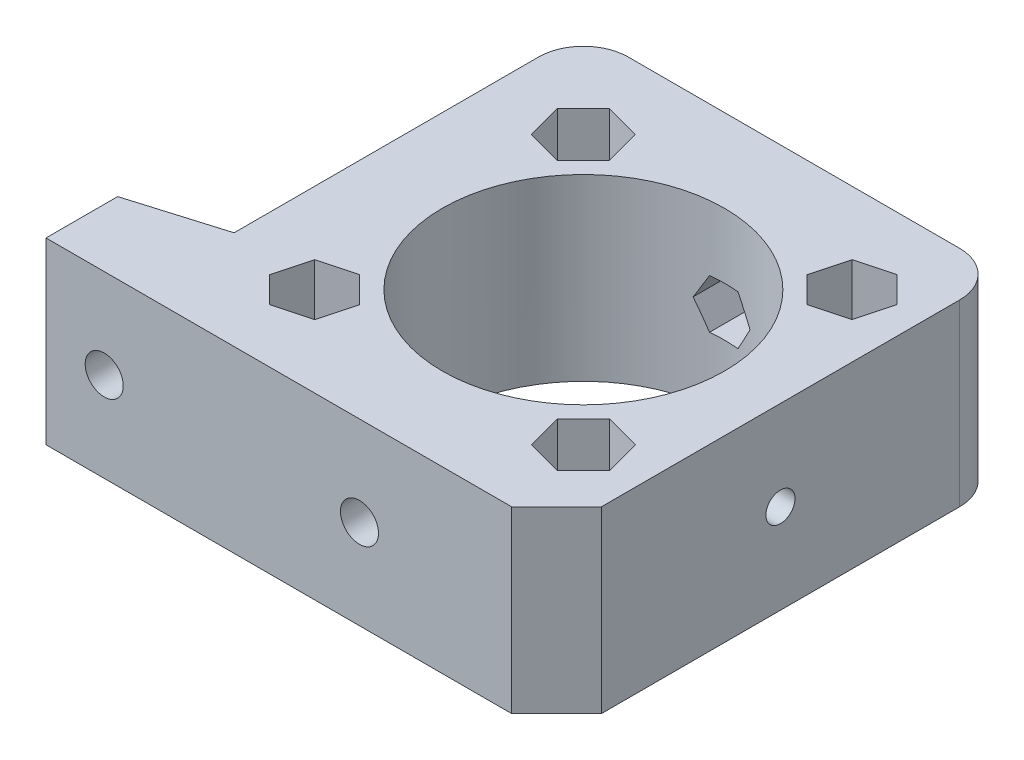
from build123d import *

# Parameters (mm, degrees)
CROQUIS1_R               = 2.125
CROQUIS1_R_2             = 15.75
SALIENTE_EXTRUIR1_DEPTH  = 20
CORTAR_EXTRUIR1_REACH    = 66.226
CROQUIS3_R               = 2.125
CORTAR_EXTRUIR2_REACH    = 71.226
CORTAR_EXTRUIR2_START    = -5
CORTAR_EXTRUIR3_DEPTH    = 10
CUT_EXTRUDE1_DEPTH       = 48.434164903
REDONDEO1_R              = 5
CUT_EXTRUDE2_DEPTH       = 48.434164903
SKETCH3_R                = 1.625
CUT_EXTRUDE3_DEPTH       = 10
CUT_EXTRUDE4_REACH       = 71.376
CUT_EXTRUDE4_START       = -4
CUT_EXTRUDE5_REACH       = 66.226
SKETCH5_R                = 1.625
CUT_EXTRUDE6_REACH       = 70.226
CUT_EXTRUDE6_START       = -4
REDONDEO1_OF_SIMETR_A1_R = 5
CROQUIS6_W               = 57
CROQUIS6_H               = 20
CORTAR_EXTRUIR4_DEPTH    = 73.972597597


with BuildPart() as part:
    # Croquis1 → Saliente-Extruir1 (new body)
    with BuildSketch(Plane(origin=(0, 0, 0), x_dir=(1, 0, 0), z_dir=(0, 1, 0))):
        Polygon((25, 25), (-25, 25), (-25, -14), (-35, -17), (-35, -25), (25, -25), align=None)
        with Locations((-15, -15)):
            Circle(CROQUIS1_R, mode=Mode.SUBTRACT)
        with Locations((15, -15)):
            Circle(CROQUIS1_R, mode=Mode.SUBTRACT)
        with Locations((-15, 15)):
            Circle(CROQUIS1_R, mode=Mode.SUBTRACT)
        Circle(CROQUIS1_R_2, mode=Mode.SUBTRACT)
        with Locations((15, 15)):
            Circle(CROQUIS1_R, mode=Mode.SUBTRACT)
    saliente_extruir1 = extrude(amount=-SALIENTE_EXTRUIR1_DEPTH)

    # Croquis3 → Cortar-Extruir1 (cut, up to next)
    with BuildSketch(Plane.XY.offset(25), mode=Mode.PRIVATE) as cortar_extruir1_sk1:
        with Locations((-28.5, -10)):
            Circle(CROQUIS3_R)
    cortar_extruir1_tool1 = extrude(cortar_extruir1_sk1.sketch, amount=-CORTAR_EXTRUIR1_REACH, mode=Mode.PRIVATE) & part.part
    # Croquis3 → Cortar-Extruir1 (cut, up to next)
    with BuildSketch(Plane.XY.offset(25), mode=Mode.PRIVATE) as cortar_extruir1_sk2:
        with Locations((0, -10)):
            Circle(CROQUIS3_R)
    cortar_extruir1_tool2 = extrude(cortar_extruir1_sk2.sketch, amount=-CORTAR_EXTRUIR1_REACH, mode=Mode.PRIVATE) & part.part
    cortar_extruir1_1 = cortar_extruir1_tool1.solids().sort_by_distance((-28.5, -10, 25))[0]
    add(cortar_extruir1_1, mode=Mode.SUBTRACT)
    cortar_extruir1_2 = cortar_extruir1_tool2.solids().sort_by_distance((0, -10, 25))[0]
    add(cortar_extruir1_2, mode=Mode.SUBTRACT)
    cortar_extruir1 = cortar_extruir1_1 + cortar_extruir1_2  # Cortar-Extruir1 as one shape, for the pattern or mirror that repeats it

    # Croquis4 → Cortar-Extruir2 (cut, up to next)
    with BuildSketch(Plane.XY.offset(25).offset(CORTAR_EXTRUIR2_START), mode=Mode.PRIVATE) as cortar_extruir2_sk1:
        Polygon((-28.5, -14.041451884), (-25, -12.020725942), (-25, -7.979274058), (-28.5, -5.958548116), (-32, -7.979274058), (-32, -12.020725942), align=None)
    cortar_extruir2_tool1 = extrude(cortar_extruir2_sk1.sketch, amount=-CORTAR_EXTRUIR2_REACH, mode=Mode.PRIVATE) & part.part
    # Croquis4 → Cortar-Extruir2 (cut, up to next)
    with BuildSketch(Plane.XY.offset(25).offset(CORTAR_EXTRUIR2_START), mode=Mode.PRIVATE) as cortar_extruir2_sk2:
        Polygon((2.020725942, -13.5), (4.041451884, -10), (2.020725942, -6.5), (-2.020725942, -6.5), (-4.041451884, -10), (-2.020725942, -13.5), align=None)
    cortar_extruir2_tool2 = extrude(cortar_extruir2_sk2.sketch, amount=-CORTAR_EXTRUIR2_REACH, mode=Mode.PRIVATE) & part.part
    cortar_extruir2_1 = cortar_extruir2_tool1.solids().sort_by_distance((-28.5, -10, 20))[0]
    add(cortar_extruir2_1, mode=Mode.SUBTRACT)
    cortar_extruir2_2 = cortar_extruir2_tool2.solids().sort_by_distance((0, -10, 20))[0]
    add(cortar_extruir2_2, mode=Mode.SUBTRACT)
    cortar_extruir2 = cortar_extruir2_1 + cortar_extruir2_2  # Cortar-Extruir2 as one shape, for the pattern or mirror that repeats it

    # Croquis5 → Cortar-Extruir3 (cut)
    with BuildSketch(Plane.XZ.offset(20)):
        Polygon((-11.040489496, 13.939052358), (-12.101437138, 17.898562862), (-16.060947642, 18.959510504), (-18.959510504, 16.060947642), (-17.898562862, 12.101437138), (-13.939052358, 11.040489496), align=None)
        Polygon((11.040489496, 13.939052358), (13.939052358, 11.040489496), (17.898562862, 12.101437138), (18.959510504, 16.060947642), (16.060947642, 18.959510504), (12.101437138, 17.898562862), align=None)
        Polygon((-13.939052358, -11.040489496), (-17.898562862, -12.101437138), (-18.959510504, -16.060947642), (-16.060947642, -18.959510504), (-12.101437138, -17.898562862), (-11.040489496, -13.939052358), align=None)
        Polygon((18.959510504, -16.060947642), (17.898562862, -12.101437138), (13.939052358, -11.040489496), (11.040489496, -13.939052358), (12.101437138, -17.898562862), (16.060947642, -18.959510504), align=None)
    cortar_extruir3 = extrude(amount=-CORTAR_EXTRUIR3_DEPTH, mode=Mode.SUBTRACT)

    # Sketch1 → Cut-Extrude1 (cut, through all)
    with BuildSketch(Plane(origin=(0, 0, 0), x_dir=(1, 0, 0), z_dir=(0, 1, 0))):
        Polygon((22, 35), (22, -25), (25, -25), (25, 25), (25, 35), align=None)
    cut_extrude1 = extrude(amount=-CUT_EXTRUDE1_DEPTH, mode=Mode.SUBTRACT)

    # Redondeo1
    redondeo1_edges = [part.edges().sort_by_distance(p)[0] for p in [
        (-25, -10, -25),
        (22, -10, -25),
    ]]
    fillet(redondeo1_edges, radius=REDONDEO1_R)

    # Sketch2 → Cut-Extrude2 (cut, through all)
    with BuildSketch(Plane(origin=(0, 0, 0), x_dir=(1, 0, 0), z_dir=(0, 1, 0))):
        Polygon((22, -25), (22, -20), (17, -25), align=None)
    cut_extrude2 = extrude(amount=-CUT_EXTRUDE2_DEPTH, mode=Mode.SUBTRACT)

    # Sketch3 → Cut-Extrude3 (cut)
    with BuildSketch(Plane(origin=(22, 0, 0), x_dir=(0, 0, -1), z_dir=(1, 0, 0))):
        with Locations((0, -10)):
            Circle(SKETCH3_R)
    cut_extrude3 = extrude(amount=-CUT_EXTRUDE3_DEPTH, mode=Mode.SUBTRACT)

    # Sketch4 → Cut-Extrude4 (cut, up to next)
    with BuildSketch(Plane(origin=(22, 0, 0), x_dir=(0, 0, -1), z_dir=(1, 0, 0)).offset(CUT_EXTRUDE4_START), mode=Mode.PRIVATE) as cut_extrude4_sk1:
        Polygon((1.58771324, -12.75), (3.175426481, -10), (1.58771324, -7.25), (-1.58771324, -7.25), (-3.175426481, -10), (-1.58771324, -12.75), align=None)
    cut_extrude4_tool1 = extrude(cut_extrude4_sk1.sketch, amount=-CUT_EXTRUDE4_REACH, mode=Mode.PRIVATE) & part.part
    cut_extrude4 = cut_extrude4_tool1.solids().sort_by_distance((18, -10, 0))[0]
    add(cut_extrude4, mode=Mode.SUBTRACT)

    # Sketch5 → Cut-Extrude5 (cut, up to next)
    with BuildSketch(Plane(origin=(0, 0, -25), x_dir=(-1, 0, 0), z_dir=(0, 0, -1)), mode=Mode.PRIVATE) as cut_extrude5_sk1:
        with Locations((0, -10)):
            Circle(SKETCH5_R)
    cut_extrude5_tool1 = extrude(cut_extrude5_sk1.sketch, amount=-CUT_EXTRUDE5_REACH, mode=Mode.PRIVATE) & part.part
    cut_extrude5 = cut_extrude5_tool1.solids().sort_by_distance((0, -10, -25))[0]
    add(cut_extrude5, mode=Mode.SUBTRACT)

    # Sketch6 → Cut-Extrude6 (cut, up to next)
    with BuildSketch(Plane(origin=(0, 0, -25), x_dir=(-1, 0, 0), z_dir=(0, 0, -1)).offset(CUT_EXTRUDE6_START), mode=Mode.PRIVATE) as cut_extrude6_sk1:
        Polygon((1.58771324, -12.75), (3.175426481, -10), (1.58771324, -7.25), (-1.58771324, -7.25), (-3.175426481, -10), (-1.58771324, -12.75), align=None)
    cut_extrude6_tool1 = extrude(cut_extrude6_sk1.sketch, amount=-CUT_EXTRUDE6_REACH, mode=Mode.PRIVATE) & part.part
    cut_extrude6 = cut_extrude6_tool1.solids().sort_by_distance((0, -10, -21))[0]
    add(cut_extrude6, mode=Mode.SUBTRACT)

    # Simetría1: Saliente-Extruir1, Cortar-Extruir1, Cortar-Extruir2, Cortar-Extruir3, Cut-Extrude1, Cut-Extrude2, Cut-Extrude3, Cut-Extrude4, Cut-Extrude5, Cut-Extrude6 across plane
    add(saliente_extruir1.mirror(Plane.ZX.offset(-20)))
    add(cortar_extruir1.mirror(Plane.ZX.offset(-20)), mode=Mode.SUBTRACT)
    add(cortar_extruir2.mirror(Plane.ZX.offset(-20)), mode=Mode.SUBTRACT)
    add(cortar_extruir3.mirror(Plane.ZX.offset(-20)), mode=Mode.SUBTRACT)
    add(cut_extrude1.mirror(Plane.ZX.offset(-20)), mode=Mode.SUBTRACT)
    add(cut_extrude2.mirror(Plane.ZX.offset(-20)), mode=Mode.SUBTRACT)
    add(cut_extrude3.mirror(Plane.ZX.offset(-20)), mode=Mode.SUBTRACT)
    add(cut_extrude4.mirror(Plane.ZX.offset(-20)), mode=Mode.SUBTRACT)
    add(cut_extrude5.mirror(Plane.ZX.offset(-20)), mode=Mode.SUBTRACT)
    add(cut_extrude6.mirror(Plane.ZX.offset(-20)), mode=Mode.SUBTRACT)

    # Redondeo1 of Simetría1
    redondeo1_of_simetr_a1_edges = [part.edges().sort_by_distance(p)[0] for p in [
        (-25, -30, -25),
        (22, -30, -25),
    ]]
    fillet(redondeo1_of_simetr_a1_edges, radius=REDONDEO1_OF_SIMETR_A1_R)

    # Croquis6 → Cortar-Extruir4 (cut, through all)
    with BuildSketch(Plane(origin=(0, 0, -25), x_dir=(-1, 0, 0), z_dir=(0, 0, -1))):
        with Locations((6.5, -10)):
            Rectangle(CROQUIS6_W, CROQUIS6_H)
    extrude(amount=-CORTAR_EXTRUIR4_DEPTH, mode=Mode.SUBTRACT)


solid = part.part
